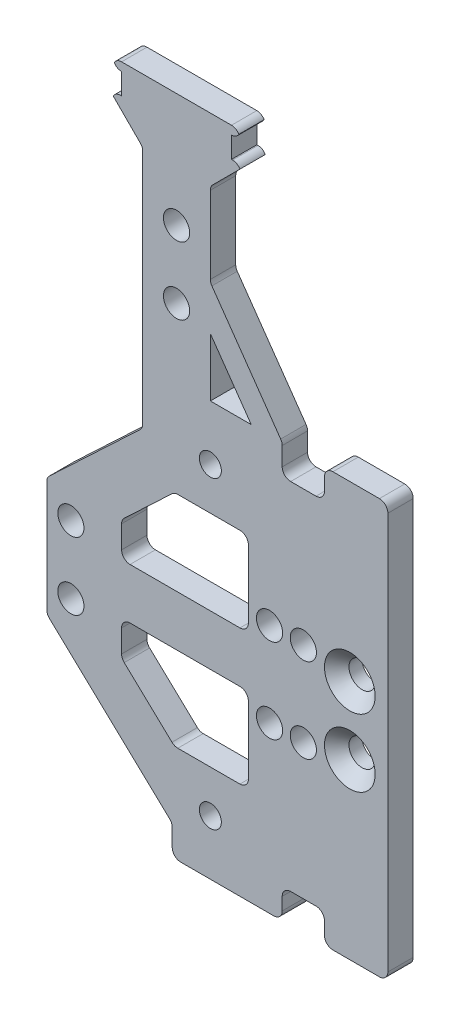
from build123d import *

# Parameters (mm, degrees)
SKETCH_1_R                   = 1.55
SKETCH_1_R_2                 = 1.3
EXTRUDE_1_DEPTH              = 3
SKETCH_3_R                   = 1.55
CUT_EXTRUDE_1_DEPTH          = 59.017238817
HOLE_WIZARD_M3_1_D           = 3.1
HOLE_WIZARD_M3_1_CSINK_D     = 6
HOLE_WIZARD_M3_1_CSINK_ANGLE = 90
FILLET_1_R                   = 1


with BuildPart() as part:
    # 草图1 → 凸台-拉伸1 (new body)
    with BuildSketch(Plane.XY):
        Polygon((-19.35, -7), (-4.509137286, -21), (-4.509137286, -24.5), (8.5, -24.5), (8.5, -21), (13.5, -21), (13.5, -24.5), (21, -24.5), (21, -12.5), (21, -5.443486713), (21, 5.443486713), (21, 12.5), (21, 24.5), (13.5, 24.5), (13.5, 21), (8.5, 21), (8.5, 24.5), (0, 36.639258057), (0, 46.5), (3.5, 50), (3.5, 50.5), (2.5, 50.5), (2.5, 53), (3.5, 53), (3.5, 54), (-11.5, 54), (-11.5, 53), (-10.5, 53), (-10.5, 50.5), (-11.5, 50.5), (-11.5, 50), (-8, 46.5), (-8, 17.70692473), (-10.85, 15.01840178), (-19.35, 7), (-19.35, 5.629370629), align=None)
        with Locations((-16.5, 4)):
            Circle(SKETCH_1_R, mode=Mode.SUBTRACT)
        with Locations((-16.5, -4)):
            Circle(SKETCH_1_R, mode=Mode.SUBTRACT)
        with Locations((16.5, 4)):
            Circle(SKETCH_1_R, mode=Mode.SUBTRACT)
        with Locations((16.5, -4)):
            Circle(SKETCH_1_R, mode=Mode.SUBTRACT)
        with Locations((0, 18)):
            Circle(SKETCH_1_R_2, mode=Mode.SUBTRACT)
        with Locations(Location((0, -18, 0), (0, 0, 180))):
            Circle(SKETCH_1_R_2, mode=Mode.SUBTRACT)
        with Locations((-4, 40.5)):
            Circle(SKETCH_1_R, mode=Mode.SUBTRACT)
        with Locations((-4, 32.5)):
            Circle(SKETCH_1_R, mode=Mode.SUBTRACT)
        Polygon((0, 24.5), (4.837676234, 24.5), (0, 31.40891767), align=None, mode=Mode.SUBTRACT)
        Polygon((-4.245815128, 13), (4.5, 13), (4.5, 3), (-10.5, 3), (-10.5, 7.100168575), align=None, mode=Mode.SUBTRACT)
        Polygon((-10.5, -3), (-10.5, -7.100168575), (-4.245815128, -13), (4.5, -13), (4.5, -3), align=None, mode=Mode.SUBTRACT)
    extrude(amount=EXTRUDE_1_DEPTH)

    # 草图3 → 切除-拉伸1 (cut, through all)
    with BuildSketch(Plane.XY.offset(3)):
        with Locations((11, 5)):
            Circle(SKETCH_3_R)
        with Locations((7, 5)):
            Circle(SKETCH_3_R)
        with Locations((11, -5)):
            Circle(SKETCH_3_R)
        with Locations((7, -5)):
            Circle(SKETCH_3_R)
    extrude(amount=-CUT_EXTRUDE_1_DEPTH, mode=Mode.SUBTRACT)

    # M3 六角凹锥坑螺钉的锥形沉头孔1 (through all)
    with Locations(Plane(origin=(16.5, -4, 3), x_dir=(1, 0, 0), z_dir=(0, 0, 1))):
        with Locations((0, 0), (0, 8)):
            CounterSinkHole(HOLE_WIZARD_M3_1_D / 2, HOLE_WIZARD_M3_1_CSINK_D / 2, counter_sink_angle=HOLE_WIZARD_M3_1_CSINK_ANGLE)

    # 圆角1
    # the kernel refuses this fillet: 1 mm, written as the material it adds along each edge
    with BuildSketch(Plane(origin=(8.5, 21, 0), x_dir=(0, 1, 0), z_dir=(0, 0, 1)), Plane(origin=(13.5, 21, 0), x_dir=(-1, 0, 0), z_dir=(0, 0, 1)), Plane(origin=(13.5, -21, 0), x_dir=(0, -1, 0), z_dir=(0, 0, 1)), Plane(origin=(8.5, -21, 0), x_dir=(1, 0, 0), z_dir=(0, 0, 1)), Plane(origin=(4.5, -13, 0), x_dir=(-1, 0, 0), z_dir=(0, 0, 1)), Plane(origin=(4.5, -3, 0), x_dir=(0, -1, 0), z_dir=(0, 0, 1)), Plane(origin=(-10.5, 3, 0), x_dir=(0, 1, 0), z_dir=(0, 0, 1)), Plane(origin=(4.5, 3, 0), x_dir=(-1, 0, 0), z_dir=(0, 0, 1)), Plane(origin=(4.5, 13, 0), x_dir=(0, -1, 0), z_dir=(0, 0, 1))) as fillet_1_piece_1:
        with BuildLine():
            CenterArc((FILLET_1_R, -FILLET_1_R), FILLET_1_R, 90, 90)
            Line((0, -FILLET_1_R), (0, 0))
            Line((0, 0), (FILLET_1_R, 0))
        make_face()
    extrude(amount=3)
    with BuildSketch(Plane(origin=(-4.509137286, -21, 0), x_dir=(-0.7274135642622264, 0.686199319824294, 0), z_dir=(0, 0, 1))) as fillet_1_piece_2:
        with BuildLine():
            CenterArc((FILLET_1_R * 0.431392395733, FILLET_1_R), FILLET_1_R, 223.33, 46.67)
            Line((-FILLET_1_R * 0.296021168529, FILLET_1_R * 0.313800680176), (0, 0))
            Line((0, 0), (FILLET_1_R * 0.431392395733, 0))
        make_face()
    extrude(amount=3)
    with BuildSketch(Plane(origin=(-10.5, -7.100168575, 0), x_dir=(0, 1, 0), z_dir=(0, 0, 1)), Plane(origin=(-10.5, 7.100168575, 0), x_dir=(0.7274135642622253, 0.6861993198242954, 0), z_dir=(0, 0, 1)), Plane(origin=(-8, 17.70692473, 0), x_dir=(-0.7274135642622253, -0.6861993198242954, 0), z_dir=(0, 0, 1))) as fillet_1_piece_3:
        with BuildLine():
            CenterArc((FILLET_1_R * 0.431392395733, -FILLET_1_R), FILLET_1_R, 90, 46.67)
            Line((-FILLET_1_R * 0.296021168529, -FILLET_1_R * 0.313800680176), (0, 0))
            Line((0, 0), (FILLET_1_R * 0.431392395733, 0))
        make_face()
    extrude(amount=3)
    with BuildSketch(Plane(origin=(-4.245815128, -13, 0), x_dir=(-0.727413564262223, 0.6861993198242976, 0), z_dir=(0, 0, 1))) as fillet_1_piece_4:
        with BuildLine():
            CenterArc((FILLET_1_R * 0.397240900512, -FILLET_1_R), FILLET_1_R, 90, 43.33)
            Line((-FILLET_1_R * 0.288958419312, -FILLET_1_R * 0.272586435738), (0, 0))
            Line((0, 0), (FILLET_1_R * 0.397240900512, 0))
        make_face()
    extrude(amount=3)
    with BuildSketch(Plane(origin=(-10.5, -3, 0), x_dir=(0, -1, 0), z_dir=(0, 0, 1))) as fillet_1_piece_5:
        with BuildLine():
            CenterArc((FILLET_1_R, FILLET_1_R), FILLET_1_R, 180, 90)
            Line((0, FILLET_1_R), (0, 0))
            Line((0, 0), (FILLET_1_R, 0))
        make_face()
    extrude(amount=3)
    with BuildSketch(Plane(origin=(-4.245815128, 13, 0), x_dir=(-0.727413564262223, -0.6861993198242976, 0), z_dir=(0, 0, 1))) as fillet_1_piece_6:
        with BuildLine():
            CenterArc((FILLET_1_R * 0.397240900512, FILLET_1_R), FILLET_1_R, 226.67, 43.33)
            Line((-FILLET_1_R * 0.288958419312, FILLET_1_R * 0.272586435738), (0, 0))
            Line((0, 0), (FILLET_1_R * 0.397240900512, 0))
        make_face()
    extrude(amount=3)
    with BuildSketch(Plane(origin=(-8, 46.5, 0), x_dir=(0, -1, 0), z_dir=(0, 0, 1)), Plane(origin=(0, 46.5, 0), x_dir=(0.7071067811865551, 0.70710678118654, 0), z_dir=(0, 0, 1))) as fillet_1_piece_7:
        with BuildLine():
            CenterArc((FILLET_1_R * 0.414213562373, -FILLET_1_R), FILLET_1_R, 90, 45)
            Line((-FILLET_1_R * 0.292893218813, -FILLET_1_R * 0.292893218813), (0, 0))
            Line((0, 0), (FILLET_1_R * 0.414213562373, 0))
        make_face()
    extrude(amount=3)
    with BuildSketch(Plane(origin=(0, 36.639258057, 0), x_dir=(0, 1, 0), z_dir=(0, 0, 1))) as fillet_1_piece_8:
        with BuildLine():
            CenterArc((FILLET_1_R * 0.315298788879, -FILLET_1_R), FILLET_1_R, 90, 35)
            Line((-FILLET_1_R * 0.258277647472, -FILLET_1_R * 0.180847955711), (0, 0))
            Line((0, 0), (FILLET_1_R * 0.315298788879, 0))
        make_face()
    extrude(amount=3)
    # the kernel refuses this fillet: 1 mm, written as the material it takes off along each edge
    with BuildSketch(Plane(origin=(13.5, 24.5, -2.5), x_dir=(1, 0, 0), z_dir=(0, 0, 1)), Plane(origin=(21, 24.5, -2.5), x_dir=(0, -1, 0), z_dir=(0, 0, 1)), Plane(origin=(21, -24.5, -2.5), x_dir=(-1, 0, 0), z_dir=(0, 0, 1)), Plane(origin=(13.5, -24.5, -2.5), x_dir=(0, 1, 0), z_dir=(0, 0, 1)), Plane(origin=(8.5, -24.5, -2.5), x_dir=(-1, 0, 0), z_dir=(0, 0, 1)), Plane(origin=(-4.509137286, -24.5, -2.5), x_dir=(0, 1, 0), z_dir=(0, 0, 1)), Plane(origin=(-11.5, 53, -2.5), x_dir=(0, 1, 0), z_dir=(0, 0, 1)), Plane(origin=(-11.5, 54, -2.5), x_dir=(1, 0, 0), z_dir=(0, 0, 1)), Plane(origin=(3.5, 54, -2.5), x_dir=(0, -1, 0), z_dir=(0, 0, 1)), Plane(origin=(3.5, 53, -2.5), x_dir=(-1, 0, 0), z_dir=(0, 0, 1))) as fillet_1_2_piece_1:
        with BuildLine():
            CenterArc((FILLET_1_R, -FILLET_1_R), FILLET_1_R, 90, 90)
            Line((0, -FILLET_1_R), (0, 0))
            Line((0, 0), (FILLET_1_R, 0))
        make_face()
    extrude(amount=8, mode=Mode.SUBTRACT)
    with BuildSketch(Plane(origin=(-19.35, -7, -1.078480989), x_dir=(0.7274135642622251, -0.6861993198242955, 0), z_dir=(0, 0, 1)), Plane(origin=(-19.35, 7, -1.078480989), x_dir=(0, -1, 0), z_dir=(0, 0, 1))) as fillet_1_2_piece_2:
        with BuildLine():
            CenterArc((FILLET_1_R * 0.431392395733, FILLET_1_R), FILLET_1_R, 223.33, 46.67)
            Line((-FILLET_1_R * 0.296021168529, FILLET_1_R * 0.313800680176), (0, 0))
            Line((0, 0), (FILLET_1_R * 0.431392395733, 0))
        make_face()
    extrude(amount=5.156961979, mode=Mode.SUBTRACT)
    with BuildSketch(Plane(origin=(-11.5, 50.5, -2.165063509), x_dir=(1, 0, 0), z_dir=(0, 0, 1))) as fillet_1_2_piece_3:
        with BuildLine():
            CenterArc((0.866025404, -1), FILLET_1_R, 90, 60)
            Line((0, -0.5), (0, 0))
            Line((0, 0), (0.866025404, 0))
        make_face()
    extrude(amount=7.330127019, mode=Mode.SUBTRACT)
    with BuildSketch(Plane(origin=(3.5, 50.5, -2.165063509), x_dir=(0, -1, 0), z_dir=(0, 0, 1))) as fillet_1_2_piece_4:
        with BuildLine():
            CenterArc((1, -0.866025404), FILLET_1_R, 120, 60)
            Line((0, -0.866025404), (0, 0))
            Line((0, 0), (0.5, 0))
        make_face()
    extrude(amount=7.330127019, mode=Mode.SUBTRACT)
    with BuildSketch(Plane(origin=(8.5, 24.5, -0.788246972), x_dir=(0, -1, 0), z_dir=(0, 0, 1))) as fillet_1_2_piece_5:
        with BuildLine():
            CenterArc((FILLET_1_R * 0.315298788879, -FILLET_1_R), FILLET_1_R, 90, 35)
            Line((-FILLET_1_R * 0.258277647472, -FILLET_1_R * 0.180847955711), (0, 0))
            Line((0, 0), (FILLET_1_R * 0.315298788879, 0))
        make_face()
    extrude(amount=4.576493944, mode=Mode.SUBTRACT)


solid = part.part
